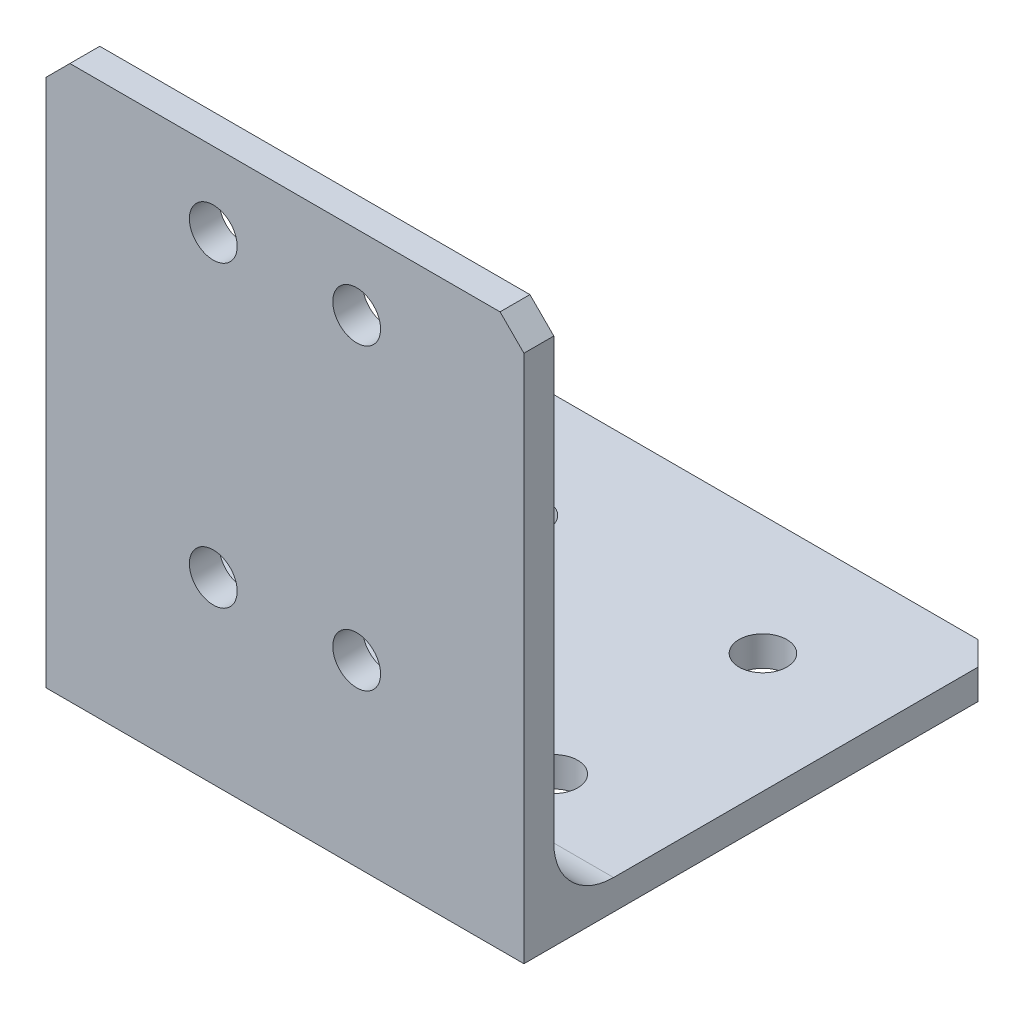
from build123d import *

# Parameters (mm, degrees)
BOSS_EXTRUDE1_DEPTH = 50.8
SKETCH2_R           = 2.54
CUT_EXTRUDE1_DEPTH  = 93.797488685
SKETCH3_R           = 2.54
CUT_EXTRUDE2_DEPTH  = 93.797488685
FILLET1_R           = 6.35
CHAMFER1_SIZE       = 2.54


with BuildPart() as part:
    # Sketch1 → Boss-Extrude1 (new body)
    with BuildSketch(Plane(origin=(0, 0, 0), x_dir=(0, 0, -1), z_dir=(1, 0, 0))):
        Polygon((0, 0), (0, 58.7375), (3.175, 58.7375), (3.175, 3.175), (50.8, 3.175), (50.8, 0), align=None)
    extrude(amount=BOSS_EXTRUDE1_DEPTH)

    # Sketch2 → Cut-Extrude1 (cut, through all)
    with BuildSketch(Plane.XY):
        with Locations((17.78, 50.8)):
            Circle(SKETCH2_R)
        with Locations((17.78, 19.05)):
            Circle(SKETCH2_R)
        with Locations((33.02, 19.05)):
            Circle(SKETCH2_R)
        with Locations((33.02, 50.8)):
            Circle(SKETCH2_R)
    extrude(amount=-CUT_EXTRUDE1_DEPTH, mode=Mode.SUBTRACT)

    # Sketch3 → Cut-Extrude2 (cut, through all)
    with BuildSketch(Plane.XZ):
        with Locations((38.1, -38.1)):
            Circle(SKETCH3_R)
        with Locations((38.1, -15.875)):
            Circle(SKETCH3_R)
        with Locations((12.7, -38.1)):
            Circle(SKETCH3_R)
        with Locations((12.7, -15.875)):
            Circle(SKETCH3_R)
    extrude(amount=-CUT_EXTRUDE2_DEPTH, mode=Mode.SUBTRACT)

    # Fillet1
    fillet1_edges = [part.edges().sort_by_distance(p)[0] for p in [
        (25.4, 3.175, -3.175),
    ]]
    fillet(fillet1_edges, radius=FILLET1_R)

    # Chamfer1
    chamfer1_edges = [part.edges().sort_by_distance(p)[0] for p in [
        (50.8, 58.7375, -1.5875),
        (0, 58.7375, -1.5875),
        (50.8, 1.5875, -50.8),
        (0, 1.5875, -50.8),
    ]]
    chamfer(chamfer1_edges, length=CHAMFER1_SIZE)


solid = part.part
